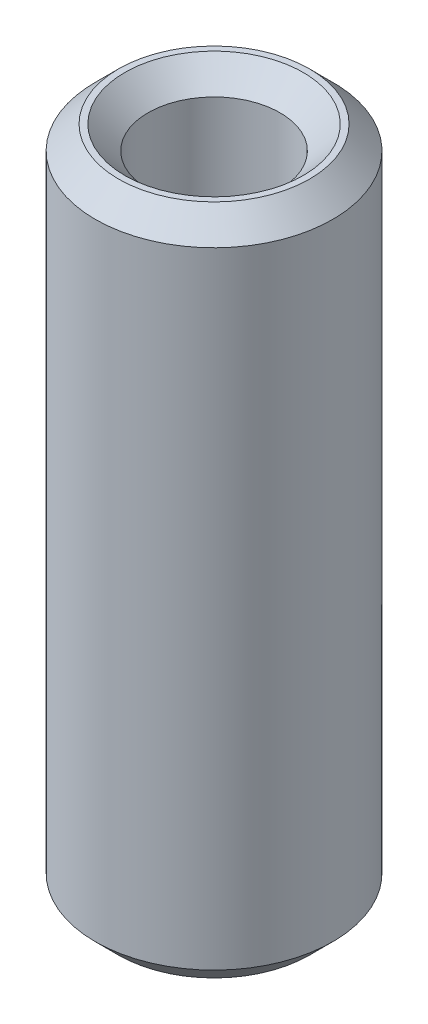
from build123d import *

# Parameters (mm, degrees)
SKETCH1_R           = 12.5
BOSS_EXTRUDE1_DEPTH = 70.741813279
SKETCH2_R           = 6.948634287
CUT_EXTRUDE1_DEPTH  = 73.917104619
CHAMFER1_SIZE       = 2.447851032


with BuildPart() as part:
    # Sketch1 → Boss-Extrude1 (new body)
    with BuildSketch(Plane(origin=(0, 0, 0), x_dir=(1, 0, 0), z_dir=(0, 1, 0))):
        Circle(SKETCH1_R)
    extrude(amount=BOSS_EXTRUDE1_DEPTH)

    # Sketch2 → Cut-Extrude1 (cut, through all)
    with BuildSketch(Plane(origin=(0, 0, 0), x_dir=(1, 0, 0), z_dir=(0, 1, 0))):
        Circle(SKETCH2_R)
    extrude(amount=CUT_EXTRUDE1_DEPTH, mode=Mode.SUBTRACT)

    # Chamfer1
    chamfer1_edges = [part.edges().sort_by_distance(p)[0] for p in [
        (-6.948634287, 70.741813279, 0),
        (-6.948634287, 0, 0),
        (-12.5, 0, 0),
        (-12.5, 70.741813279, 0),
    ]]
    chamfer(chamfer1_edges, length=CHAMFER1_SIZE)


solid = part.part
